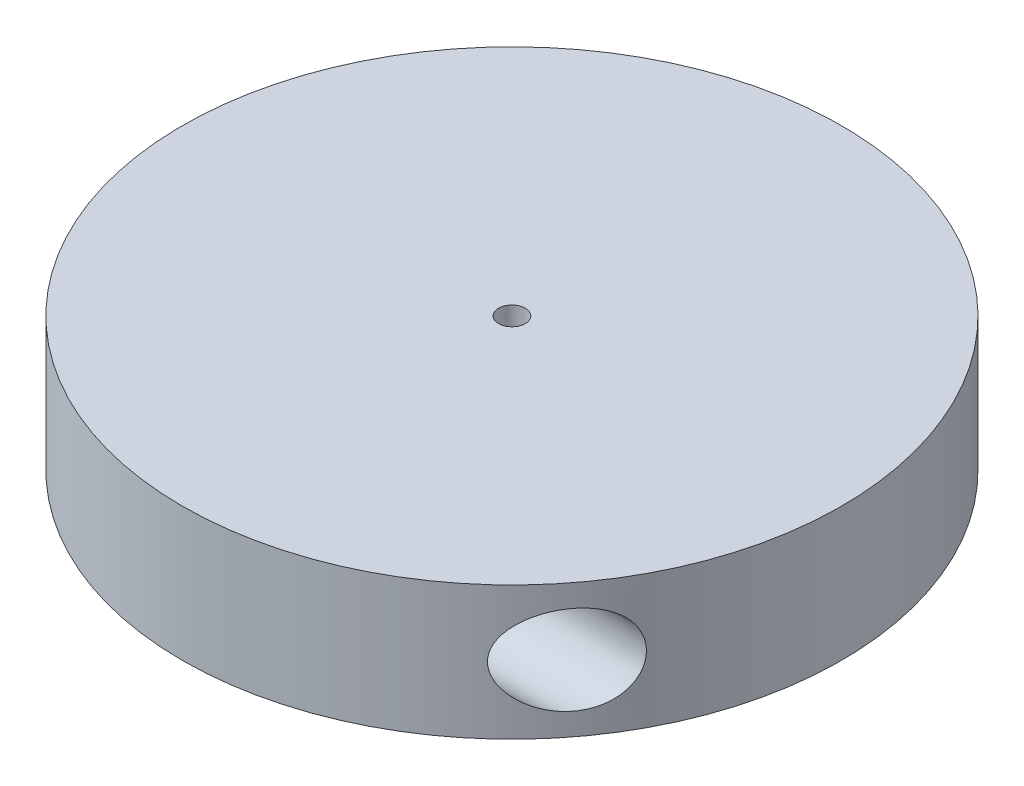
from build123d import *

# Parameters (mm, degrees)
SKETCH1_R           = 74
BOSS_EXTRUDE1_DEPTH = 30
SKETCH2_R           = 10
CUT_EXTRUDE1_DEPTH  = 80
SKETCH3_R           = 10
CUT_EXTRUDE2_DEPTH  = 80
SKETCH6_R           = 3
CUT_EXTRUDE4_DEPTH  = 30


with BuildPart() as part:
    # Sketch1 → Boss-Extrude1 (new body)
    with BuildSketch(Plane(origin=(0, 0, 0), x_dir=(1, 0, 0), z_dir=(0, 1, 0))):
        Circle(SKETCH1_R)
    extrude(amount=BOSS_EXTRUDE1_DEPTH)

    # Sketch2 → Cut-Extrude1 (cut)
    with BuildSketch(Plane(origin=(0, 0, 0), x_dir=(0, 0, -1), z_dir=(1, 0, 0))):
        with Locations((45, 15)):
            Circle(SKETCH2_R)
    extrude(amount=-CUT_EXTRUDE1_DEPTH, mode=Mode.SUBTRACT)

    # Sketch3 → Cut-Extrude2 (cut)
    with BuildSketch(Plane(origin=(0, 0, 0), x_dir=(0, 0, -1), z_dir=(1, 0, 0))):
        with Locations((-45, 15)):
            Circle(SKETCH3_R)
    extrude(amount=CUT_EXTRUDE2_DEPTH, mode=Mode.SUBTRACT)

    # Sketch6 → Cut-Extrude4 (cut)
    with BuildSketch(Plane(origin=(0, 30, 0), x_dir=(1, 0, 0), z_dir=(0, 1, 0))):
        Circle(SKETCH6_R)
    extrude(amount=-CUT_EXTRUDE4_DEPTH, mode=Mode.SUBTRACT)


solid = part.part
